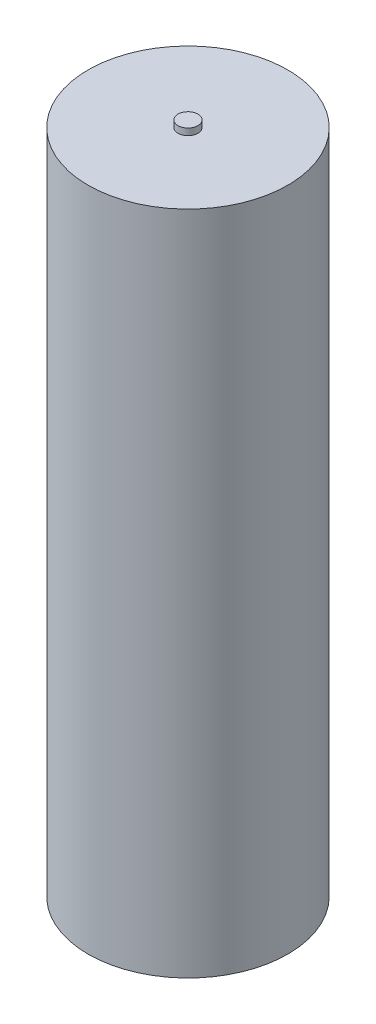
from build123d import *

# Parameters (mm, degrees)
SKETCH1_R           = 1500
BOSS_EXTRUDE1_DEPTH = 10000
SKETCH2_R           = 150
BOSS_EXTRUDE2_DEPTH = 100


with BuildPart() as part:
    # Sketch1 → Boss-Extrude1 (new body)
    with BuildSketch(Plane(origin=(0, 0, 0), x_dir=(1, 0, 0), z_dir=(0, 1, 0))):
        Circle(SKETCH1_R)
    extrude(amount=BOSS_EXTRUDE1_DEPTH)

    # Sketch2 → Boss-Extrude2 (add)
    with BuildSketch(Plane(origin=(0, 10000, 0), x_dir=(1, 0, 0), z_dir=(0, 1, 0))):
        Circle(SKETCH2_R)
    extrude(amount=BOSS_EXTRUDE2_DEPTH)


solid = part.part
